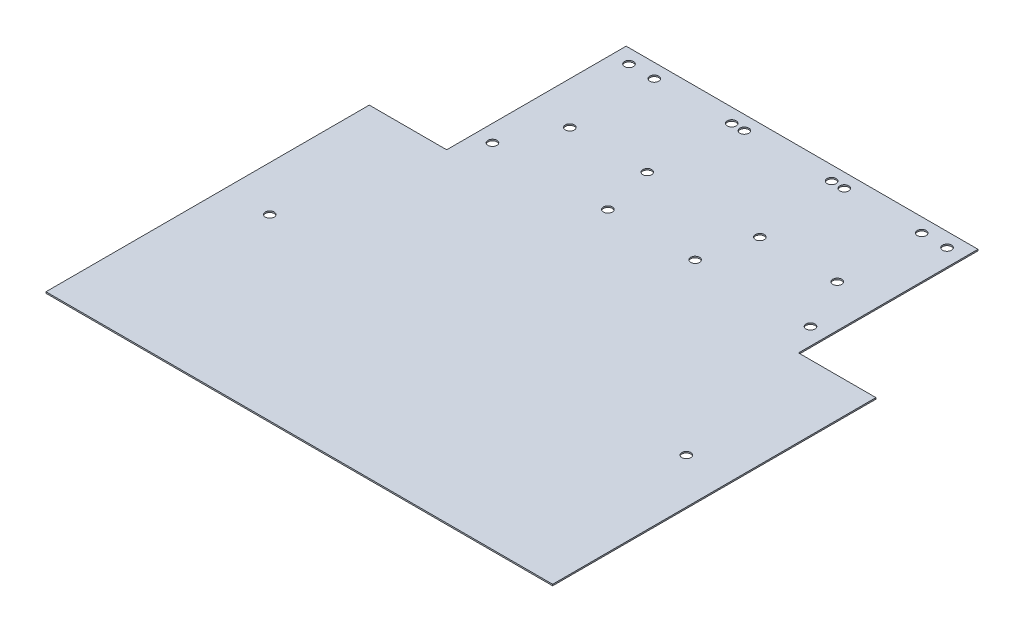
from build123d import *

# Parameters (mm, degrees)
SALIENTE_EXTRUIR1_DEPTH = 0.5
CORTAR_EXTRUIR1_REACH   = 202.939
CORTAR_EXTRUIR4_REACH   = 128.793
CROQUIS6_R              = 1.585
CORTAR_EXTRUIR5_REACH   = 128.793
CROQUIS7_R              = 1.585
CORTAR_EXTRUIR6_REACH   = 128.793
CROQUIS8_R              = 1.585
CORTAR_EXTRUIR7_REACH   = 128.793
CROQUIS9_R              = 1.585
CORTAR_EXTRUIR8_REACH   = 128.793
CROQUIS5_R              = 1.585


with BuildPart() as part:
    # Croquis2 → Saliente-Extruir1 (new body)
    with BuildSketch(Plane(origin=(0, 0, 0), x_dir=(1, 0, 0), z_dir=(0, 1, 0))):
        Polygon((-90, 25.54), (-62.5, 25.54), (-62.5, 89.31), (62.5, 89.31), (62.5, 25.54), (90, 25.54), (90, -89.31), (-90, -89.31), align=None)
    saliente_extruir1 = extrude(amount=SALIENTE_EXTRUIR1_DEPTH)

    # Croquis3 → Cortar-Extruir1 (cut, up to next)
    with BuildSketch(Plane(origin=(90, 0, 0), x_dir=(0, 0, -1), z_dir=(1, 0, 0)), mode=Mode.PRIVATE) as cortar_extruir1_sk1:
        Polygon((-89.31, 0), (-87.93626129, 0.5), (-89.31, 0.5), align=None)
    cortar_extruir1_tool1 = extrude(cortar_extruir1_sk1.sketch, amount=-CORTAR_EXTRUIR1_REACH, mode=Mode.PRIVATE) & part.part
    add(cortar_extruir1_tool1.solids().sort_by_distance((90, 0.333333, 88.852087))[0], mode=Mode.SUBTRACT)

    # Croquis6 → Cortar-Extruir4 (cut, up to next)
    with BuildSketch(Plane(origin=(0, 0.5, 0), x_dir=(1, 0, 0), z_dir=(0, 1, 0)), mode=Mode.PRIVATE) as cortar_extruir4_sk1:
        with Locations((-56.5, 35.81)):
            Circle(CROQUIS6_R)
    cortar_extruir4_tool1 = extrude(cortar_extruir4_sk1.sketch, amount=-CORTAR_EXTRUIR4_REACH, mode=Mode.PRIVATE) & part.part
    # Croquis6 → Cortar-Extruir4 (cut, up to next)
    with BuildSketch(Plane(origin=(0, 0.5, 0), x_dir=(1, 0, 0), z_dir=(0, 1, 0)), mode=Mode.PRIVATE) as cortar_extruir4_sk2:
        with Locations((-15.5, 35.81)):
            Circle(CROQUIS6_R)
    cortar_extruir4_tool2 = extrude(cortar_extruir4_sk2.sketch, amount=-CORTAR_EXTRUIR4_REACH, mode=Mode.PRIVATE) & part.part
    # Croquis6 → Cortar-Extruir4 (cut, up to next)
    with BuildSketch(Plane(origin=(0, 0.5, 0), x_dir=(1, 0, 0), z_dir=(0, 1, 0)), mode=Mode.PRIVATE) as cortar_extruir4_sk3:
        with Locations((-15.5, 84.31)):
            Circle(CROQUIS6_R)
    cortar_extruir4_tool3 = extrude(cortar_extruir4_sk3.sketch, amount=-CORTAR_EXTRUIR4_REACH, mode=Mode.PRIVATE) & part.part
    # Croquis6 → Cortar-Extruir4 (cut, up to next)
    with BuildSketch(Plane(origin=(0, 0.5, 0), x_dir=(1, 0, 0), z_dir=(0, 1, 0)), mode=Mode.PRIVATE) as cortar_extruir4_sk4:
        with Locations((-56.5, 84.31)):
            Circle(CROQUIS6_R)
    cortar_extruir4_tool4 = extrude(cortar_extruir4_sk4.sketch, amount=-CORTAR_EXTRUIR4_REACH, mode=Mode.PRIVATE) & part.part
    add(cortar_extruir4_tool1.solids().sort_by_distance((-56.5, 0.5, -35.81))[0], mode=Mode.SUBTRACT)
    add(cortar_extruir4_tool2.solids().sort_by_distance((-15.5, 0.5, -35.81))[0], mode=Mode.SUBTRACT)
    add(cortar_extruir4_tool3.solids().sort_by_distance((-15.5, 0.5, -84.31))[0], mode=Mode.SUBTRACT)
    add(cortar_extruir4_tool4.solids().sort_by_distance((-56.5, 0.5, -84.31))[0], mode=Mode.SUBTRACT)

    # Croquis7 → Cortar-Extruir5 (cut, up to next)
    with BuildSketch(Plane(origin=(0, 0.5, 0), x_dir=(1, 0, 0), z_dir=(0, 1, 0)), mode=Mode.PRIVATE) as cortar_extruir5_sk1:
        with Locations((56.5, 35.81)):
            Circle(CROQUIS7_R)
    cortar_extruir5_tool1 = extrude(cortar_extruir5_sk1.sketch, amount=-CORTAR_EXTRUIR5_REACH, mode=Mode.PRIVATE) & part.part
    # Croquis7 → Cortar-Extruir5 (cut, up to next)
    with BuildSketch(Plane(origin=(0, 0.5, 0), x_dir=(1, 0, 0), z_dir=(0, 1, 0)), mode=Mode.PRIVATE) as cortar_extruir5_sk2:
        with Locations((15.5, 35.81)):
            Circle(CROQUIS7_R)
    cortar_extruir5_tool2 = extrude(cortar_extruir5_sk2.sketch, amount=-CORTAR_EXTRUIR5_REACH, mode=Mode.PRIVATE) & part.part
    # Croquis7 → Cortar-Extruir5 (cut, up to next)
    with BuildSketch(Plane(origin=(0, 0.5, 0), x_dir=(1, 0, 0), z_dir=(0, 1, 0)), mode=Mode.PRIVATE) as cortar_extruir5_sk3:
        with Locations((15.5, 84.31)):
            Circle(CROQUIS7_R)
    cortar_extruir5_tool3 = extrude(cortar_extruir5_sk3.sketch, amount=-CORTAR_EXTRUIR5_REACH, mode=Mode.PRIVATE) & part.part
    # Croquis7 → Cortar-Extruir5 (cut, up to next)
    with BuildSketch(Plane(origin=(0, 0.5, 0), x_dir=(1, 0, 0), z_dir=(0, 1, 0)), mode=Mode.PRIVATE) as cortar_extruir5_sk4:
        with Locations((56.5, 84.31)):
            Circle(CROQUIS7_R)
    cortar_extruir5_tool4 = extrude(cortar_extruir5_sk4.sketch, amount=-CORTAR_EXTRUIR5_REACH, mode=Mode.PRIVATE) & part.part
    add(cortar_extruir5_tool1.solids().sort_by_distance((56.5, 0.5, -35.81))[0], mode=Mode.SUBTRACT)
    add(cortar_extruir5_tool2.solids().sort_by_distance((15.5, 0.5, -35.81))[0], mode=Mode.SUBTRACT)
    add(cortar_extruir5_tool3.solids().sort_by_distance((15.5, 0.5, -84.31))[0], mode=Mode.SUBTRACT)
    add(cortar_extruir5_tool4.solids().sort_by_distance((56.5, 0.5, -84.31))[0], mode=Mode.SUBTRACT)

    # Simetría3: Saliente-Extruir1 across plane
    add(saliente_extruir1.mirror(Plane(origin=(0, 0, 0), x_dir=(0, 0, 1), z_dir=(1, 0, 0))))

    # Croquis8 → Cortar-Extruir6 (cut, up to next)
    with BuildSketch(Plane(origin=(0, 0.5, 0), x_dir=(1, 0, 0), z_dir=(0, 1, 0)), mode=Mode.PRIVATE) as cortar_extruir6_sk1:
        with Locations((-20, 54.31)):
            Circle(CROQUIS8_R)
    cortar_extruir6_tool1 = extrude(cortar_extruir6_sk1.sketch, amount=-CORTAR_EXTRUIR6_REACH, mode=Mode.PRIVATE) & part.part
    # Croquis8 → Cortar-Extruir6 (cut, up to next)
    with BuildSketch(Plane(origin=(0, 0.5, 0), x_dir=(1, 0, 0), z_dir=(0, 1, 0)), mode=Mode.PRIVATE) as cortar_extruir6_sk2:
        with Locations((-47.5, 54.31)):
            Circle(CROQUIS8_R)
    cortar_extruir6_tool2 = extrude(cortar_extruir6_sk2.sketch, amount=-CORTAR_EXTRUIR6_REACH, mode=Mode.PRIVATE) & part.part
    # Croquis8 → Cortar-Extruir6 (cut, up to next)
    with BuildSketch(Plane(origin=(0, 0.5, 0), x_dir=(1, 0, 0), z_dir=(0, 1, 0)), mode=Mode.PRIVATE) as cortar_extruir6_sk3:
        with Locations((-47.5, 84.31)):
            Circle(CROQUIS8_R)
    cortar_extruir6_tool3 = extrude(cortar_extruir6_sk3.sketch, amount=-CORTAR_EXTRUIR6_REACH, mode=Mode.PRIVATE) & part.part
    # Croquis8 → Cortar-Extruir6 (cut, up to next)
    with BuildSketch(Plane(origin=(0, 0.5, 0), x_dir=(1, 0, 0), z_dir=(0, 1, 0)), mode=Mode.PRIVATE) as cortar_extruir6_sk4:
        with Locations((-20, 84.31)):
            Circle(CROQUIS8_R)
    cortar_extruir6_tool4 = extrude(cortar_extruir6_sk4.sketch, amount=-CORTAR_EXTRUIR6_REACH, mode=Mode.PRIVATE) & part.part
    cortar_extruir6_1 = cortar_extruir6_tool1.solids().sort_by_distance((-20, 0.5, -54.31))[0]
    add(cortar_extruir6_1, mode=Mode.SUBTRACT)
    cortar_extruir6_2 = cortar_extruir6_tool2.solids().sort_by_distance((-47.5, 0.5, -54.31))[0]
    add(cortar_extruir6_2, mode=Mode.SUBTRACT)
    cortar_extruir6_3 = cortar_extruir6_tool3.solids().sort_by_distance((-47.5, 0.5, -84.31))[0]
    add(cortar_extruir6_3, mode=Mode.SUBTRACT)
    cortar_extruir6_4 = cortar_extruir6_tool4.solids().sort_by_distance((-20, 0.5, -84.31))[0]
    add(cortar_extruir6_4, mode=Mode.SUBTRACT)
    cortar_extruir6 = cortar_extruir6_1 + cortar_extruir6_2 + cortar_extruir6_3 + cortar_extruir6_4  # Cortar-Extruir6 as one shape, for the pattern or mirror that repeats it

    # Simetría4: Cortar-Extruir6 across plane
    add(cortar_extruir6.mirror(Plane(origin=(0, 0, 0), x_dir=(0, 0, 1), z_dir=(1, 0, 0))), mode=Mode.SUBTRACT)

    # Croquis9 → Cortar-Extruir7 (cut, up to next)
    with BuildSketch(Plane.XZ, mode=Mode.PRIVATE) as cortar_extruir7_sk1:
        with Locations((56.5, -35.81)):
            Circle(CROQUIS9_R)
    cortar_extruir7_tool1 = extrude(cortar_extruir7_sk1.sketch, amount=-CORTAR_EXTRUIR7_REACH, mode=Mode.PRIVATE) & part.part
    # Croquis9 → Cortar-Extruir7 (cut, up to next)
    with BuildSketch(Plane.XZ, mode=Mode.PRIVATE) as cortar_extruir7_sk2:
        with Locations((15.5, -35.81)):
            Circle(CROQUIS9_R)
    cortar_extruir7_tool2 = extrude(cortar_extruir7_sk2.sketch, amount=-CORTAR_EXTRUIR7_REACH, mode=Mode.PRIVATE) & part.part
    # Croquis9 → Cortar-Extruir7 (cut, up to next)
    with BuildSketch(Plane.XZ, mode=Mode.PRIVATE) as cortar_extruir7_sk3:
        with Locations((15.5, -84.31)):
            Circle(CROQUIS9_R)
    cortar_extruir7_tool3 = extrude(cortar_extruir7_sk3.sketch, amount=-CORTAR_EXTRUIR7_REACH, mode=Mode.PRIVATE) & part.part
    # Croquis9 → Cortar-Extruir7 (cut, up to next)
    with BuildSketch(Plane.XZ, mode=Mode.PRIVATE) as cortar_extruir7_sk4:
        with Locations((56.5, -84.31)):
            Circle(CROQUIS9_R)
    cortar_extruir7_tool4 = extrude(cortar_extruir7_sk4.sketch, amount=-CORTAR_EXTRUIR7_REACH, mode=Mode.PRIVATE) & part.part
    cortar_extruir7_1 = cortar_extruir7_tool1.solids().sort_by_distance((56.5, 0, -35.81))[0]
    add(cortar_extruir7_1, mode=Mode.SUBTRACT)
    cortar_extruir7_2 = cortar_extruir7_tool2.solids().sort_by_distance((15.5, 0, -35.81))[0]
    add(cortar_extruir7_2, mode=Mode.SUBTRACT)
    cortar_extruir7_3 = cortar_extruir7_tool3.solids().sort_by_distance((15.5, 0, -84.31))[0]
    add(cortar_extruir7_3, mode=Mode.SUBTRACT)
    cortar_extruir7_4 = cortar_extruir7_tool4.solids().sort_by_distance((56.5, 0, -84.31))[0]
    add(cortar_extruir7_4, mode=Mode.SUBTRACT)
    cortar_extruir7 = cortar_extruir7_1 + cortar_extruir7_2 + cortar_extruir7_3 + cortar_extruir7_4  # Cortar-Extruir7 as one shape, for the pattern or mirror that repeats it

    # Simetría5: Cortar-Extruir7 across plane
    add(cortar_extruir7.mirror(Plane(origin=(0, 0, 0), x_dir=(0, 0, 1), z_dir=(1, 0, 0))), mode=Mode.SUBTRACT)

    # Croquis5 → Cortar-Extruir8 (cut, up to next)
    with BuildSketch(Plane(origin=(0, 0.5, 0), x_dir=(1, 0, 0), z_dir=(0, 1, 0)), mode=Mode.PRIVATE) as cortar_extruir8_sk1:
        with Locations((74, -25.820403824)):
            Circle(CROQUIS5_R)
    cortar_extruir8_tool1 = extrude(cortar_extruir8_sk1.sketch, amount=-CORTAR_EXTRUIR8_REACH, mode=Mode.PRIVATE) & part.part
    cortar_extruir8 = cortar_extruir8_tool1.solids().sort_by_distance((74, 0.5, 25.820404))[0]
    add(cortar_extruir8, mode=Mode.SUBTRACT)

    # Simetría6: Cortar-Extruir8 across plane
    add(cortar_extruir8.mirror(Plane(origin=(0, 0, 0), x_dir=(0, 0, 1), z_dir=(1, 0, 0))), mode=Mode.SUBTRACT)


solid = part.part
